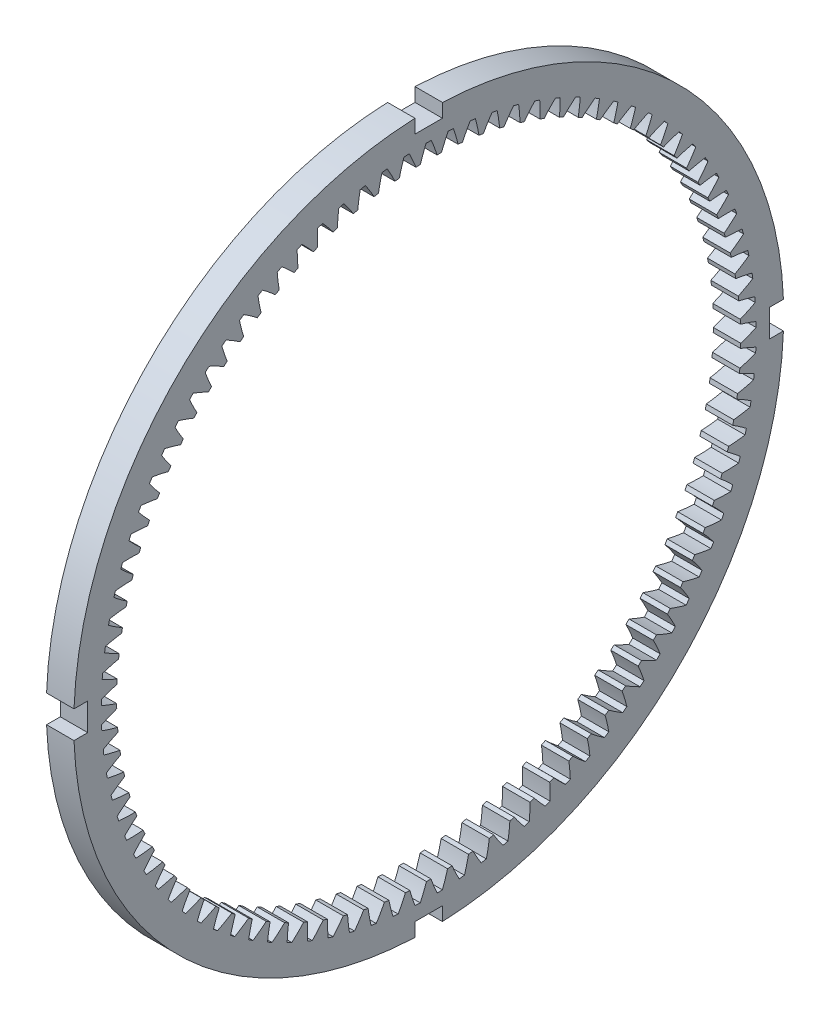
from build123d import *

# Parameters (mm, degrees)
BASPROSKE_W         = 30
BASPROSKE_H         = 5.6514
TOOTHCUT_DEPTH      = 172.503319629
TEETHCUTS_COUNT     = 93
TEETHCUTS_ANGLE     = 356.129032258
EXTRUDE_START       = -30
SKETCH_2_R          = 119.4014
EXTRUDE_1_DEPTH     = 30
CUT_EXTRUDE_START   = -20
CUT_EXTRUDE_1_DEPTH = 20


with BuildPart() as part:
    # BasProSke → Base-Revolve (revolve)
    with BuildSketch(Plane(origin=(0, 0, 0), x_dir=(1, 0, 0), z_dir=(0, 1, 0)), mode=Mode.PRIVATE) as base_revolve_sk:
        with Locations((15, 116.5757)):
            Rectangle(BASPROSKE_W, BASPROSKE_H)
    revolve(base_revolve_sk.sketch.rotate(Axis((-10, 0, 0), (1, 0, 0)), 180), axis=Axis((-10, 0, 0), (1, 0, 0)))

    # TooCutSke → ToothCut (cut, through all)
    with BuildSketch(Plane(origin=(0, 0, 0), x_dir=(0, 0, -1), z_dir=(1, 0, 0))):
        with BuildLine():
            ThreePointArc((3.028541619, 113.684267077), (2.062882279, 116.555350637), (0.948961292, 119.372228129))
            ThreePointArc((0.948961292, 119.372228129), (0, 119.376), (-0.948961292, 119.372228129))
            ThreePointArc((-0.948961292, 119.372228129), (-2.062882279, 116.555350637), (-3.028541619, 113.684267077))
            ThreePointArc((-3.028541619, 113.684267077), (0, 113.7246), (3.028541619, 113.684267077))
        make_face()
    toothcut = extrude(amount=TOOTHCUT_DEPTH, mode=Mode.SUBTRACT)

    # TeethCuts: ToothCut ×93 about axis
    teethcuts_axis = Axis((-10, 0, 0), (1, 0, 0))
    for i in range(1, TEETHCUTS_COUNT):
        add(toothcut.rotate(teethcuts_axis, i * TEETHCUTS_ANGLE / (TEETHCUTS_COUNT - 1)), mode=Mode.SUBTRACT)

    # 草圖2 → 填料-伸長1 (add)
    with BuildSketch(Plane.ZY.offset(EXTRUDE_START)):
        with BuildLine():
            Line((5, 129.304765272), (5, 124.304765272))
            Line((5, 124.304765272), (-5, 124.304765272))
            Line((-5, 124.304765272), (-5, 129.304765272))
            ThreePointArc((-5, 129.304765272), (-91.500607435, 91.500607435), (-129.304765272, 5))
            Line((-129.304765272, 5), (-124.304765272, 5))
            Line((-124.304765272, 5), (-124.304765272, -5))
            Line((-124.304765272, -5), (-129.304765272, -5))
            ThreePointArc((-129.304765272, -5), (-91.500607435, -91.500607435), (-5, -129.304765272))
            Line((-5, -129.304765272), (-5, -124.304765272))
            Line((-5, -124.304765272), (5, -124.304765272))
            Line((5, -124.304765272), (5, -129.304765272))
            ThreePointArc((5, -129.304765272), (91.500607435, -91.500607435), (129.304765272, -5))
            Line((129.304765272, -5), (124.304765272, -5))
            Line((124.304765272, -5), (124.304765272, 5))
            Line((124.304765272, 5), (129.304765272, 5))
            ThreePointArc((129.304765272, 5), (91.500607435, 91.500607435), (5, 129.304765272))
        make_face()
        Circle(SKETCH_2_R, mode=Mode.SUBTRACT)
    extrude(amount=EXTRUDE_1_DEPTH)

    # 草圖3 → 除料-伸長1 (cut)
    with BuildSketch(Plane.ZY.offset(CUT_EXTRUDE_START)):
        with BuildLine():
            Line((-129.304765272, 5), (-124.304765272, 5))
            Line((-124.304765272, 5), (-124.304765272, -5))
            Line((-124.304765272, -5), (-129.304765272, -5))
            ThreePointArc((-129.304765272, -5), (-91.500607435, -91.500607435), (-5, -129.304765272))
            Line((-5, -129.304765272), (-5, -124.304765272))
            Line((-5, -124.304765272), (5, -124.304765272))
            Line((5, -124.304765272), (5, -129.304765272))
            ThreePointArc((5, -129.304765272), (91.500607435, -91.500607435), (129.304765272, -5))
            Line((129.304765272, -5), (124.304765272, -5))
            Line((124.304765272, -5), (124.304765272, 5))
            Line((124.304765272, 5), (129.304765272, 5))
            ThreePointArc((129.304765272, 5), (91.500607435, 91.500607435), (5, 129.304765272))
            Line((5, 129.304765272), (5, 124.304765272))
            Line((5, 124.304765272), (-5, 124.304765272))
            Line((-5, 124.304765272), (-5, 129.304765272))
            ThreePointArc((-5, 129.304765272), (-91.500607435, 91.500607435), (-129.304765272, 5))
        make_face()
    extrude(amount=CUT_EXTRUDE_1_DEPTH, mode=Mode.SUBTRACT)


solid = part.part
